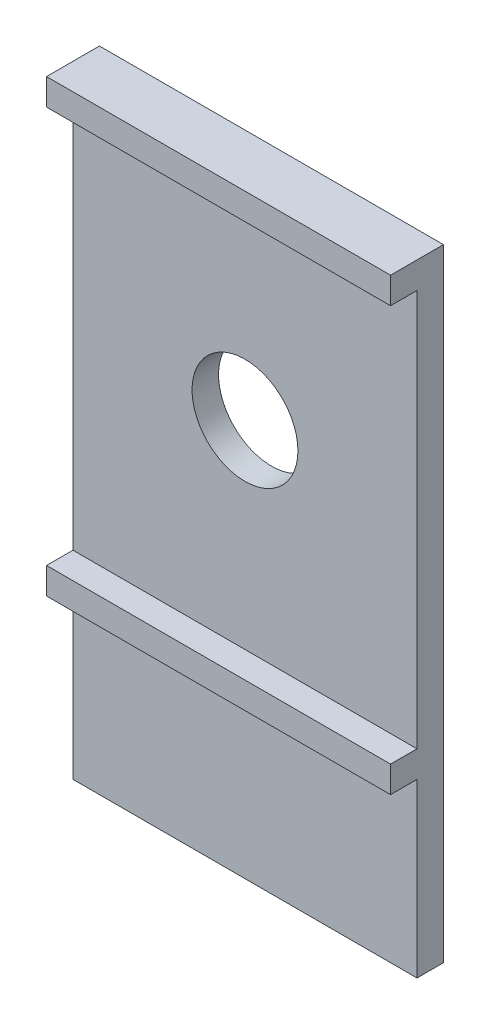
from build123d import *

# Parameters (mm, degrees)
SKICA1_W                 = 13
SKICA1_H                 = 23.5
P_IDAT_VYSUNUT_M1_DEPTH  = 1
SKICA2_W                 = 13
SKICA2_H                 = 1
P_IDAT_VYSUNUT_M2_DEPTH  = 1
SKICA3_R                 = 2
ODEBRAT_VYSUNUT_M1_DEPTH = 1


with BuildPart() as part:
    # Skica1 → Přidat vysunutím1 (new body)
    with BuildSketch(Plane.XY):
        with Locations((6.5, 11.75)):
            Rectangle(SKICA1_W, SKICA1_H)
    extrude(amount=P_IDAT_VYSUNUT_M1_DEPTH)

    # Skica2 → Přidat vysunutím2 (add)
    with BuildSketch(Plane.XY.offset(1)):
        with Locations((6.5, 23)):
            Rectangle(SKICA2_W, SKICA2_H)
        with Locations((6.5, 7)):
            Rectangle(SKICA2_W, SKICA2_H)
    extrude(amount=P_IDAT_VYSUNUT_M2_DEPTH)

    # Skica3 → Odebrat vysunutím1 (cut)
    with BuildSketch(Plane.XY.offset(1)):
        with Locations((6.5, 15)):
            Circle(SKICA3_R)
    extrude(amount=-ODEBRAT_VYSUNUT_M1_DEPTH, mode=Mode.SUBTRACT)


solid = part.part
